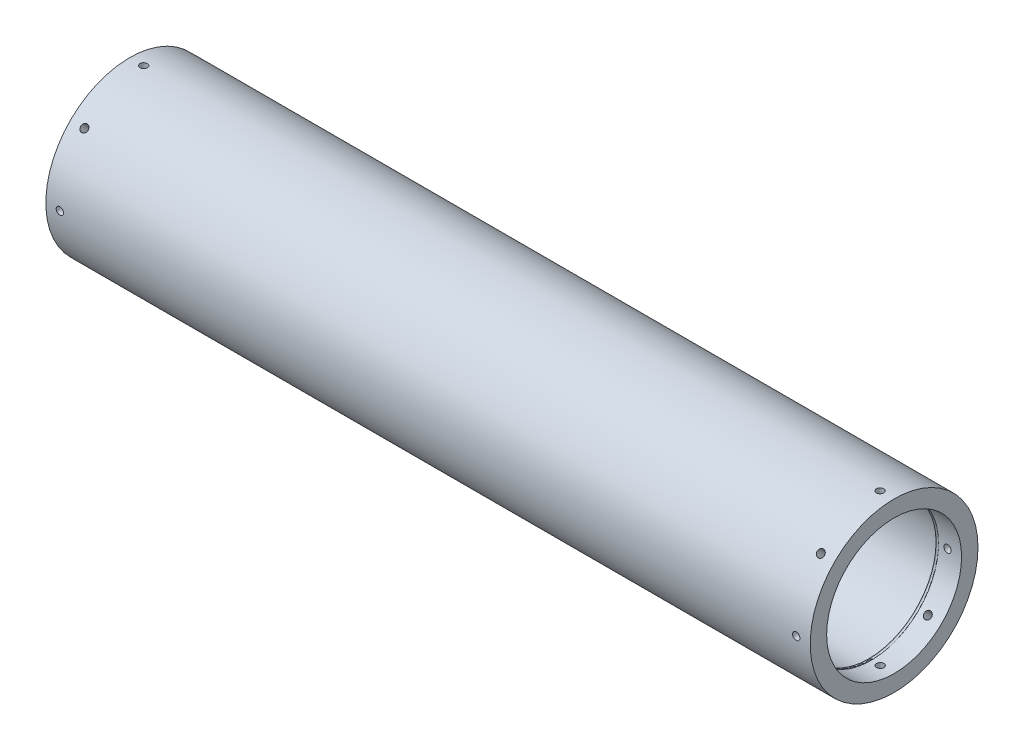
from build123d import *

# Parameters (mm, degrees)
SKETCH1_R           = 57.15
SKETCH1_R_2         = 45.9486
BOSS_EXTRUDE1_DEPTH = 520.7
SKETCH2_R           = 45.9486
SKETCH2_R_2         = 44.5262
BOSS_EXTRUDE2_DEPTH = 95.25
SKETCH3_R           = 0.889
SKETCH4_R           = 2.4892
CUT_EXTRUDE1_DEPTH  = 19.05
CIRPATTERN1_COUNT   = 8
SKETCH5_R           = 2.4892
CUT_EXTRUDE2_DEPTH  = 19.05
CIRPATTERN2_COUNT   = 8
SKETCH6_R           = 0.889


with BuildPart() as part:
    # Sketch1 → Boss-Extrude1 (new body)
    with BuildSketch(Plane(origin=(0, 0, 0), x_dir=(0, 0, -1), z_dir=(1, 0, 0))):
        Circle(SKETCH1_R)
        Circle(SKETCH1_R_2, mode=Mode.SUBTRACT)
    extrude(amount=BOSS_EXTRUDE1_DEPTH)

    # Sketch2 → Boss-Extrude2 (add)
    with BuildSketch(Plane.ZY):
        Circle(SKETCH2_R)
        Circle(SKETCH2_R_2, mode=Mode.SUBTRACT)
    extrude(amount=-BOSS_EXTRUDE2_DEPTH)

    # Sketch3 → Cut-Revolve1 (revolve, cut)
    with BuildSketch(Plane.XY):
        with Locations((16.51, 44.323)):
            Circle(SKETCH3_R)
    revolve(axis=Axis((0, 0, 0), (1, 0, 0)), mode=Mode.SUBTRACT)

    # Sketch4 → Cut-Extrude1 (cut)
    with BuildSketch(Plane.XY.offset(57.15)):
        with Locations((9.525, 0)):
            Circle(SKETCH4_R)
    cut_extrude1 = extrude(amount=-CUT_EXTRUDE1_DEPTH, mode=Mode.SUBTRACT)

    # CirPattern1: Cut-Extrude1 ×8 about axis
    cirpattern1_axis = Axis((520.7, 0, 0), (-1, 0, 0))
    for i in range(1, CIRPATTERN1_COUNT):
        add(cut_extrude1.rotate(cirpattern1_axis, i * 360 / CIRPATTERN1_COUNT), mode=Mode.SUBTRACT)

    # Sketch5 → Cut-Extrude2 (cut)
    with BuildSketch(Plane.XY.offset(57.15)):
        with Locations((511.175, 0)):
            Circle(SKETCH5_R)
    cut_extrude2 = extrude(amount=-CUT_EXTRUDE2_DEPTH, mode=Mode.SUBTRACT)

    # CirPattern2: Cut-Extrude2 ×8 about axis
    cirpattern2_axis = Axis((520.7, 0, 0), (-1, 0, 0))
    for i in range(1, CIRPATTERN2_COUNT):
        add(cut_extrude2.rotate(cirpattern2_axis, i * 360 / CIRPATTERN2_COUNT), mode=Mode.SUBTRACT)

    # Sketch6 → Cut-Revolve2 (revolve, cut)
    with BuildSketch(Plane.XY):
        with Locations((504.19, 45.72)):
            Circle(SKETCH6_R)
    revolve(axis=Axis((0, 0, 0), (1, 0, 0)), mode=Mode.SUBTRACT)


solid = part.part
